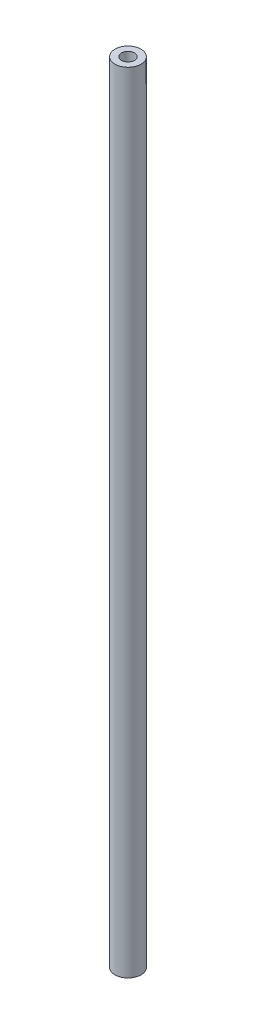
from build123d import *

# Parameters (mm, degrees)
SKETCH1_R           = 6.35
SKETCH1_R_2         = 3.175
BOSS_EXTRUDE1_DEPTH = 384.302


with BuildPart() as part:
    # Sketch1 → Boss-Extrude1 (new body)
    with BuildSketch(Plane(origin=(0, 0, 0), x_dir=(1, 0, 0), z_dir=(0, 1, 0))):
        Circle(SKETCH1_R)
        Circle(SKETCH1_R_2, mode=Mode.SUBTRACT)
    extrude(amount=BOSS_EXTRUDE1_DEPTH)


solid = part.part
